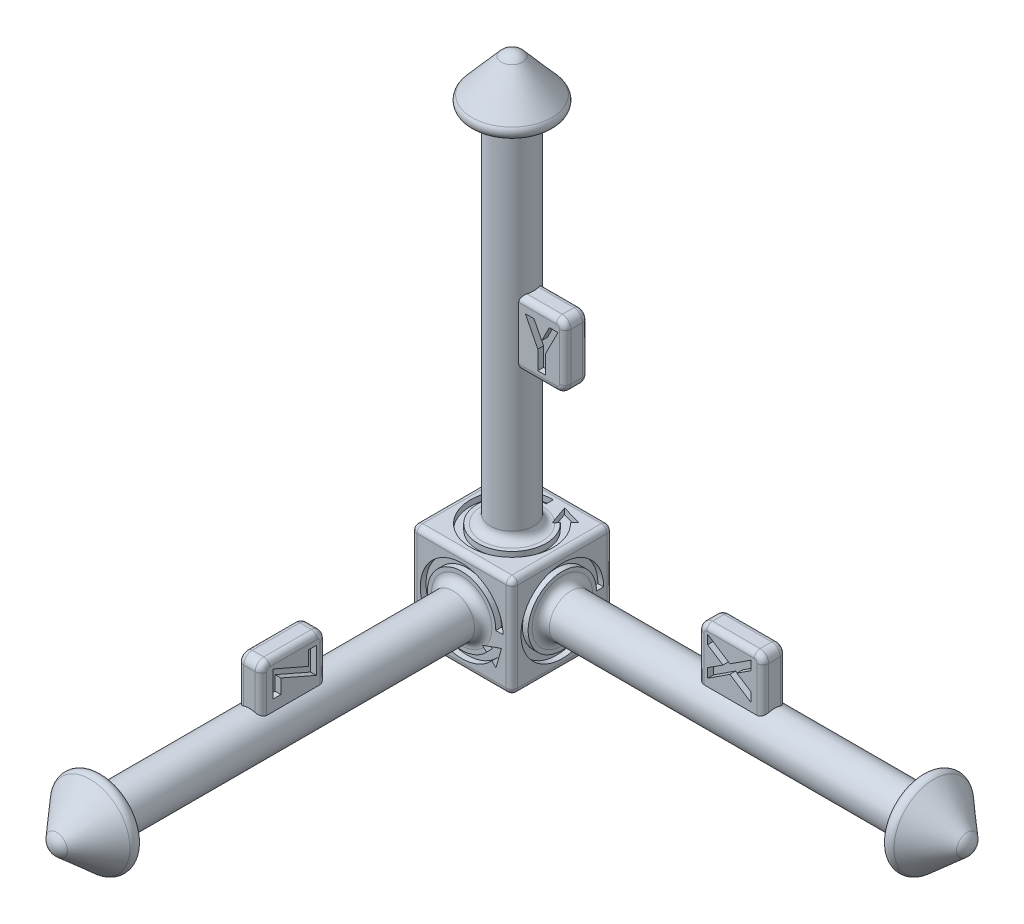
from build123d import *

# Parameters (mm, degrees)
FILLET1_R             = 1
SKETCH3_W             = 14
SKETCH3_H             = 14
BLOCK_DEPTH           = 14
X_AXIS_MATE_ANGLE     = 90
Z_AXIS_MATE_ANGLE     = 90
NEG_X_CUT_DEPTH       = 1.2
SKETCH6_W             = 9
SKETCH6_H             = 9
Y_FLAG_DEPTH          = 1.6
Y_CUT_DEPTH           = 0.8
SKETCH9_W             = 9
SKETCH9_H             = 10
X_FLAG_DEPTH          = 1.6
X_CUT_DEPTH           = 0.8
SKETCH11_W            = 9
SKETCH11_H            = 9
Z_FLAG_DEPTH          = 1.6
Z_CUT_DEPTH           = 0.8
NEG_Z_COUNT           = 2
NEG_Z_ANGLE           = 90
X_START               = -0.8
X_ROT_DEPTH           = 0.8
Y_ROT_COUNT           = 2
Y_ROT_ANGLE           = 90
Z_ROT_COUNT           = 2
Z_ROT_ANGLE           = 90
NEG_Y_COUNT           = 2
NEG_Y_ANGLE           = 90
SKETCH20_W            = 1.384615385
SKETCH20_H            = 0.666666667
NEG_X_LABEL_DEPTH     = 1.2
SKETCH21_W            = 1.384615385
SKETCH21_H            = 0.666666667
NEG_Z_LABEL_DEPTH     = 1.2
SKETCH22_W            = 0.666666667
SKETCH22_H            = 1.384615384
NEG_Y_LABEL_DEPTH     = 1.2
Y_LABEL_REVERSE_COUNT = 2
Z_LABEL_REVERSE_COUNT = 2
X_LABEL_REVERSE_COUNT = 2
FLAG_EDGE_R           = 0.8
FLAG_CORNER_R         = 1.2
CUBE_R                = 0.8
ARROWS_R              = 1.2


with BuildPart() as part:
    # Sketch1 → Y axis (revolve)
    with BuildSketch(Plane(origin=(0, 0, 0), x_dir=(0, 0, -1), z_dir=(1, 0, 0))):
        with BuildLine():
            Line((3, 50), (7, 50))
            Line((7, 50), (1.486725664, 56.300884956))
            ThreePointArc((1.486725664, 56.300884956), (0.816314478, 56.79896791), (0, 56.975513824))
            Line((0, 56.975513824), (0, 50))
            Line((0, 50), (0, 0))
            Line((0, 0), (3, 0))
            Line((3, 0), (3, 50))
        make_face()
    revolve(axis=Axis((0, 0, 0), (0, 1, 0)))

    # Fillet1
    fillet1_edges = [part.edges().sort_by_distance(p)[0] for p in [
        (0, 50, 7),
    ]]
    fillet(fillet1_edges, radius=FILLET1_R)


with BuildPart() as body_2:
    # Sketch3 → block (new body)
    with BuildSketch(Plane(origin=(0, 0, 0), x_dir=(-1, 0, 0), z_dir=(0, -1, 0))):
        Rectangle(SKETCH3_W, SKETCH3_H)
    extrude(amount=BLOCK_DEPTH)

    # Sketch5 → neg X cut (cut)
    with BuildSketch(Plane.ZY.offset(7)):
        with BuildLine():
            Line((3.464101615, -3.75), (2.880673975, -4.297368421))
            Line((2.880673975, -4.297368421), (5.539270206, -5.231106113))
            Line((5.539270206, -5.231106113), (4.776813806, -2.518421053))
            Line((4.776813806, -2.518421053), (4.193386166, -3.065789474))
            ThreePointArc((4.193386166, -3.065789474), (-5.346703211, -9.115482161), (5.75, -7))
            Line((5.75, -7), (4.75, -7))
            ThreePointArc((4.75, -7), (-4.416841783, -8.74757222), (3.464101615, -3.75))
        make_face()
    neg_x_cut = extrude(amount=-NEG_X_CUT_DEPTH, mode=Mode.SUBTRACT)


with BuildPart() as body_3:
    # X axis: copy of part
    add(part.part.moved(Location((30, 0, 0))))


with BuildPart() as body_3_1:
    # X axis mate: read off the stored shape, not the designer's step
    # X axis mate: moved
    add(body_3.part.moved(Location((-23, 7, 0))).rotate(Axis((0, 0, 0), (0, 0, -1)), X_AXIS_MATE_ANGLE))


with BuildPart() as body_4:
    # Z axis: copy of part
    add(part.part.moved(Location((30, 0, 0))))


with BuildPart() as body_4_1:
    # Z axis mate: read off the stored shape, not the designer's step
    # Z axis mate: moved
    add(body_4.part.moved(Location((-30, 7, 7))).rotate(Axis((0, 0, 0), (1, 0, 0)), Z_AXIS_MATE_ANGLE))


with BuildPart() as part_1:
    add(part.part)

    # Combine1: union body 2, body 3, body 4
    add(body_2.part)
    add(body_3_1.part)
    add(body_4_1.part)

    # Sketch6 → Y flag (add, symmetric)
    with BuildSketch(Plane.XY):
        with Locations((4.5, 25)):
            Rectangle(SKETCH6_W, SKETCH6_H)
    extrude(amount=Y_FLAG_DEPTH, both=True)

    # Sketch7 → Y cut (cut)
    with BuildSketch(Plane.XY.offset(1.6)):
        Polygon((3.461165446, 27.8), (4.659482754, 27.8), (5.730396216, 25.695432692), (6.801309677, 27.8), (7.999626985, 27.8), (6.268857754, 24.398557692), (6.268857754, 21.8), (5.191934677, 21.8), (5.191934677, 24.398557692), align=None)
    y_cut = extrude(amount=-Y_CUT_DEPTH, mode=Mode.SUBTRACT)

    # Sketch9 → X flag (add, symmetric)
    with BuildSketch(Plane.XY):
        with Locations((32, -2)):
            Rectangle(SKETCH9_W, SKETCH9_H)
    extrude(amount=X_FLAG_DEPTH, both=True)

    # Sketch10 → X cut (cut)
    with BuildSketch(Plane.XY.offset(1.6)):
        Polygon((34.8, 1.750828908), (34.8, 0.481598139), (32.873317308, -0.772007631), (34.8, -2.028017246), (34.8, -3.298449938), (31.898557692, -1.406623015), (28.8, -3.423449938), (28.8, -2.154219169), (30.925, -0.772007631), (28.8, 0.613809677), (28.8, 1.884242369), (31.899759615, -0.137392246), align=None)
    x_cut = extrude(amount=-X_CUT_DEPTH, mode=Mode.SUBTRACT)

    # Sketch11 → Z flag (add, symmetric)
    with BuildSketch(Plane(origin=(0, 0, 0), x_dir=(0, 0, -1), z_dir=(1, 0, 0))):
        with Locations((-32, -2.5)):
            Rectangle(SKETCH11_W, SKETCH11_H)
    extrude(amount=Z_FLAG_DEPTH, both=True)

    # Sketch13 → Z cut (cut)
    with BuildSketch(Plane(origin=(1.6, 0, 0), x_dir=(0, 0, -1), z_dir=(1, 0, 0))):
        Polygon((-34.8, -2.923449938), (-34.8, 0.691934677), (-29.876923077, -1.457103784), (-29.876923077, 0.538088523), (-28.8, 0.538088523), (-28.8, -3.077296092), (-33.723076923, -0.927055707), (-33.723076923, -2.923449938), align=None)
    z_cut = extrude(amount=-Z_CUT_DEPTH, mode=Mode.SUBTRACT)

    # neg Z: neg X cut ×2 about axis
    neg_z_axis = Axis((0, 0, 0), (0, -1, 0))
    for i in range(1, NEG_Z_COUNT):
        add(neg_x_cut.rotate(neg_z_axis, i * NEG_Z_ANGLE / (NEG_Z_COUNT - 1)), mode=Mode.SUBTRACT)

    # Sketch19 → X rot (cut)
    with BuildSketch(Plane(origin=(7, 0, 0), x_dir=(0, 0, -1), z_dir=(1, 0, 0)).offset(X_START)):
        with BuildLine():
            Line((4.75, -7), (5.75, -7))
            ThreePointArc((5.75, -7), (-5.346703211, -4.884517839), (4.193386166, -10.934210526))
            Line((4.193386166, -10.934210526), (4.776813806, -11.481578947))
            Line((4.776813806, -11.481578947), (5.539270206, -8.768893887))
            Line((5.539270206, -8.768893887), (2.880673975, -9.702631579))
            Line((2.880673975, -9.702631579), (3.464101615, -10.25))
            ThreePointArc((3.464101615, -10.25), (-4.416841783, -5.25242778), (4.75, -7))
        make_face()
    x_rot = extrude(amount=X_ROT_DEPTH, mode=Mode.SUBTRACT)

    # Y rot: X rot ×2 about axis
    y_rot_axis = Axis((0, -7, 0), (0, 0, 1))
    for i in range(1, Y_ROT_COUNT):
        add(x_rot.rotate(y_rot_axis, i * Y_ROT_ANGLE / (Y_ROT_COUNT - 1)), mode=Mode.SUBTRACT)

    # Z rot: X rot ×2 about axis
    z_rot_axis = Axis((0, 0, 0), (0, -1, 0))
    for i in range(1, Z_ROT_COUNT):
        add(x_rot.rotate(z_rot_axis, i * Z_ROT_ANGLE / (Z_ROT_COUNT - 1)), mode=Mode.SUBTRACT)

    # neg Y: neg X cut ×2 about axis
    neg_y_axis = Axis((0, -7, 0), (0, 0, 1))
    for i in range(1, NEG_Y_COUNT):
        add(neg_x_cut.rotate(neg_y_axis, i * NEG_Y_ANGLE / (NEG_Y_COUNT - 1)), mode=Mode.SUBTRACT)

    # Sketch20 → neg X label (cut)
    with BuildSketch(Plane.ZY.offset(7)):
        with Locations((-2.871794872, -7.538461539)):
            Rectangle(SKETCH20_W, SKETCH20_H)
        Polygon((-1.500801282, -5), (-0.654647436, -5), (0.181089744, -6.284455128), (1.018429487, -5), (1.865384615, -5), (0.604166667, -6.934294872), (1.948717949, -9), (1.102564103, -9), (0.181089744, -7.583333333), (-0.742788462, -9), (-1.58974359, -9), (-0.241987179, -6.93349359), align=None)
    extrude(amount=-NEG_X_LABEL_DEPTH, mode=Mode.SUBTRACT)

    # Sketch21 → neg Z label (cut)
    with BuildSketch(Plane(origin=(0, 0, -7), x_dir=(-1, 0, 0), z_dir=(0, 0, -1))):
        with Locations((-2.384615384, -7.538461539)):
            Rectangle(SKETCH21_W, SKETCH21_H)
        Polygon((-0.974358974, -5), (1.435897436, -5), (0.003205128, -8.282051282), (1.333333333, -8.282051282), (1.333333333, -9), (-1.076923077, -9), (0.356570513, -5.717948718), (-0.974358974, -5.717948718), align=None)
    extrude(amount=-NEG_Z_LABEL_DEPTH, mode=Mode.SUBTRACT)

    # Sketch22 → neg Y label (cut)
    with BuildSketch(Plane(origin=(0, -14, 0), x_dir=(-1, 0, 0), z_dir=(0, -1, 0))):
        with Locations((0.538461539, -2.717948718)):
            Rectangle(SKETCH22_W, SKETCH22_H)
        Polygon((-2, -1.435897436), (-2, -0.637019231), (-0.596955128, 0.076923077), (-2, 0.790865385), (-2, 1.58974359), (0.267628205, 0.435897436), (2, 0.435897436), (2, -0.282051282), (0.267628205, -0.282051282), align=None)
    extrude(amount=-NEG_Y_LABEL_DEPTH, mode=Mode.SUBTRACT)

    # y label reverse: Y cut ×2 about axis
    y_label_reverse_axis = Axis((5.768857754, 0, 0), (0, 1, 0))
    for i in range(1, Y_LABEL_REVERSE_COUNT):
        add(y_cut.rotate(y_label_reverse_axis, i * 360 / Y_LABEL_REVERSE_COUNT), mode=Mode.SUBTRACT)

    # Z label reverse: Z cut ×2 about axis
    z_label_reverse_axis = Axis((0, -1.231142246, 0), (0, 0, 1))
    for i in range(1, Z_LABEL_REVERSE_COUNT):
        add(z_cut.rotate(z_label_reverse_axis, i * 360 / Z_LABEL_REVERSE_COUNT), mode=Mode.SUBTRACT)

    # X label reverse: X cut ×2 about axis
    x_label_reverse_axis = Axis((0, -0.731142246, 0), (1, 0, 0))
    for i in range(1, X_LABEL_REVERSE_COUNT):
        add(x_cut.rotate(x_label_reverse_axis, i * 360 / X_LABEL_REVERSE_COUNT), mode=Mode.SUBTRACT)

    # flag edge
    flag_edge_edges = [part_1.edges().sort_by_distance(p)[0] for p in [
        (27.5, -0.731142246, 1.6),
        (-1.6, -1.231142246, 36.5),
        (-1.6, -1.231142246, 27.5),
        (-1.6, 2, 32),
        (1.6, -1.231142246, 27.5),
        (1.6, 2, 32),
        (1.6, -1.231142246, 36.5),
        (5.768857754, 20.5, -1.6),
        (9, 25, -1.6),
        (5.768857754, 29.5, -1.6),
        (5.768857754, 20.5, 1.6),
        (9, 25, 1.6),
        (5.768857754, 29.5, 1.6),
        (27.5, -0.731142246, -1.6),
        (36.5, -0.731142246, -1.6),
        (32, 3, -1.6),
        (36.5, -0.731142246, 1.6),
        (32, 3, 1.6),
    ]]
    fillet(flag_edge_edges, radius=FLAG_EDGE_R)

    # flag corner
    # the kernel refuses this fillet: 1.2 mm, written as the material it takes off along each edge
    with BuildSketch(Plane(origin=(7.8, 21.7, -1.6), x_dir=(1, 0, 0), z_dir=(0, 1, 0))) as flag_corner_piece_1:
        with BuildLine():
            CenterArc((0.4, -0.8), 0.8, 0, 90)
            Line((1.2, -0.8), (1.2, 0))
            Line((1.2, 0), (0.4, 0))
        make_face()
    revolve(axis=Axis((7.8, 21.7, -1.6), (0, 0, -1)), revolution_arc=90, mode=Mode.SUBTRACT)
    with BuildSketch(Plane(origin=(7.8, 28.3, -1.6), x_dir=(0, 1, 0), z_dir=(-1, 0, 0))) as flag_corner_piece_2:
        with BuildLine():
            CenterArc((0.4, -0.8), 0.8, 0, 90)
            Line((1.2, -0.8), (1.2, 0))
            Line((1.2, 0), (0.4, 0))
        make_face()
    revolve(axis=Axis((7.8, 28.3, -1.6), (0, 0, -1)), revolution_arc=90, mode=Mode.SUBTRACT)
    with BuildSketch(Plane(origin=(-1.6, 0.8, 28.7), x_dir=(0, 1, 0), z_dir=(0, 0, 1))) as flag_corner_piece_3:
        with BuildLine():
            CenterArc((0.4, -0.8), 0.8, 0, 90)
            Line((1.2, -0.8), (1.2, 0))
            Line((1.2, 0), (0.4, 0))
        make_face()
    revolve(axis=Axis((-1.6, 0.8, 28.7), (-1, 0, 0)), revolution_arc=90, mode=Mode.SUBTRACT)
    with BuildSketch(Plane(origin=(-1.6, 0.8, 35.3), x_dir=(0, 0, 1), z_dir=(0, -1, 0))) as flag_corner_piece_4:
        with BuildLine():
            CenterArc((0.4, -0.8), 0.8, 0, 90)
            Line((1.2, -0.8), (1.2, 0))
            Line((1.2, 0), (0.4, 0))
        make_face()
    revolve(axis=Axis((-1.6, 0.8, 35.3), (-1, 0, 0)), revolution_arc=90, mode=Mode.SUBTRACT)
    with BuildSketch(Plane(origin=(1.6, 0.8, 35.3), x_dir=(0, 1, 0), z_dir=(0, 0, -1))) as flag_corner_piece_5:
        with BuildLine():
            CenterArc((0.4, -0.8), 0.8, 0, 90)
            Line((1.2, -0.8), (1.2, 0))
            Line((1.2, 0), (0.4, 0))
        make_face()
    revolve(axis=Axis((1.6, 0.8, 35.3), (1, 0, 0)), revolution_arc=90, mode=Mode.SUBTRACT)
    with BuildSketch(Plane(origin=(1.6, 0.8, 28.7), x_dir=(0, 1.4400332778071367e-12, -1.0), z_dir=(0, -1.0, -1.4400332778071367e-12))) as flag_corner_piece_6:
        with BuildLine():
            CenterArc((0.4, -0.8), 0.8, 0, 90)
            Line((1.2, -0.8), (1.2, 0))
            Line((1.2, 0), (0.4, 0))
        make_face()
    revolve(axis=Axis((1.6, 0.8, 28.7), (1, 0, 0)), revolution_arc=90, mode=Mode.SUBTRACT)
    with BuildSketch(Plane(origin=(7.8, 21.7, 1.6), x_dir=(0, -1, 0), z_dir=(-1, 0, 0))) as flag_corner_piece_7:
        with BuildLine():
            CenterArc((0.4, -0.8), 0.8, 0, 90)
            Line((1.2, -0.8), (1.2, 0))
            Line((1.2, 0), (0.4, 0))
        make_face()
    revolve(axis=Axis((7.8, 21.7, 1.6), (0, 0, 1)), revolution_arc=90, mode=Mode.SUBTRACT)
    with BuildSketch(Plane(origin=(7.8, 28.3, 1.6), x_dir=(1, 0, 0), z_dir=(0, -1, 0))) as flag_corner_piece_8:
        with BuildLine():
            CenterArc((0.4, -0.8), 0.8, 0, 90)
            Line((1.2, -0.8), (1.2, 0))
            Line((1.2, 0), (0.4, 0))
        make_face()
    revolve(axis=Axis((7.8, 28.3, 1.6), (0, 0, 1)), revolution_arc=90, mode=Mode.SUBTRACT)
    with BuildSketch(Plane(origin=(35.3, 1.8, 1.6), x_dir=(1, 0, 0), z_dir=(0, -1, 0))) as flag_corner_piece_9:
        with BuildLine():
            CenterArc((0.4, -0.8), 0.8, 0, 90)
            Line((1.2, -0.8), (1.2, 0))
            Line((1.2, 0), (0.4, 0))
        make_face()
    revolve(axis=Axis((35.3, 1.8, 1.6), (0, 0, 1)), revolution_arc=90, mode=Mode.SUBTRACT)
    with BuildSketch(Plane(origin=(28.7, 1.8, 1.6), x_dir=(0, 1, 0), z_dir=(1, 0, 0))) as flag_corner_piece_10:
        with BuildLine():
            CenterArc((0.4, -0.8), 0.8, 0, 90)
            Line((1.2, -0.8), (1.2, 0))
            Line((1.2, 0), (0.4, 0))
        make_face()
    revolve(axis=Axis((28.7, 1.8, 1.6), (0, 0, 1)), revolution_arc=90, mode=Mode.SUBTRACT)
    with BuildSketch(Plane(origin=(35.3, 1.8, -1.6), x_dir=(0, 1, 0), z_dir=(-1, 0, 0))) as flag_corner_piece_11:
        with BuildLine():
            CenterArc((0.4, -0.8), 0.8, 0, 90)
            Line((1.2, -0.8), (1.2, 0))
            Line((1.2, 0), (0.4, 0))
        make_face()
    revolve(axis=Axis((35.3, 1.8, -1.6), (0, 0, -1)), revolution_arc=90, mode=Mode.SUBTRACT)
    with BuildSketch(Plane(origin=(28.7, 1.8, -1.6), x_dir=(-1, 0, 0), z_dir=(0, -1, 0))) as flag_corner_piece_12:
        with BuildLine():
            CenterArc((0.4, -0.8), 0.8, 0, 90)
            Line((1.2, -0.8), (1.2, 0))
            Line((1.2, 0), (0.4, 0))
        make_face()
    revolve(axis=Axis((28.7, 1.8, -1.6), (0, 0, -1)), revolution_arc=90, mode=Mode.SUBTRACT)
    with BuildSketch(Plane(origin=(9, 29.5, -1.6), x_dir=(-1, 0, 0), z_dir=(0, 0, 1))) as flag_corner_piece_13:
        with BuildLine():
            CenterArc((FLAG_CORNER_R, FLAG_CORNER_R), FLAG_CORNER_R, 180, 90)
            Line((0, FLAG_CORNER_R), (0, 0))
            Line((0, 0), (FLAG_CORNER_R, 0))
        make_face()
    extrude(amount=3.2, mode=Mode.SUBTRACT)
    with BuildSketch(Plane(origin=(9, 20.5, -1.6), x_dir=(-1, 0, 0), z_dir=(0, 0, 1)), Plane(origin=(1.6, 2, 36.5), x_dir=(0, -1, 0), z_dir=(-1, 0, 0)), Plane(origin=(-1.6, 2, 27.5), x_dir=(0, -1.0, -1.4388490399162743e-12), z_dir=(1, 0, 0)), Plane(origin=(27.5, 3, 1.6), x_dir=(0, -1, 0), z_dir=(0, 0, -1)), Plane(origin=(36.5, 3, -1.6), x_dir=(0, -1, 0), z_dir=(0, 0, 1))) as flag_corner_piece_14:
        with BuildLine():
            CenterArc((FLAG_CORNER_R, -FLAG_CORNER_R), FLAG_CORNER_R, 90, 90)
            Line((0, -FLAG_CORNER_R), (0, 0))
            Line((0, 0), (FLAG_CORNER_R, 0))
        make_face()
    extrude(amount=3.2, mode=Mode.SUBTRACT)

    # cube
    cube_edges = [part_1.edges().sort_by_distance(p)[0] for p in [
        (7, 0, 0),
        (7, -7, -7),
        (0, 0, 7),
        (7, -7, 7),
        (-7, 0, 0),
        (-7, -7, 7),
        (0, 0, -7),
        (-7, -7, -7),
        (7, -14, 0),
        (0, -14, 7),
        (-7, -14, 0),
        (0, -14, -7),
    ]]
    fillet(cube_edges, radius=CUBE_R)

    # arrows
    # the kernel refuses this fillet: 1.2 mm, written as the material it adds along each edge
    with BuildSketch(Plane(origin=(7, -7, 0), x_dir=(0, 0, -1), z_dir=(0, -1, 0))) as arrows_piece_1_section:
        with BuildLine():
            CenterArc((3 + ARROWS_R, ARROWS_R), ARROWS_R, 180, 90)
            Line((3, ARROWS_R), (3, 0))
            Line((3, 0), (3 + ARROWS_R, 0))
        make_face()
    arrows_piece_1 = revolve(axis=Axis((7, -7, 0), (1, 0, 0)), mode=Mode.PRIVATE)
    arrows_piece_1 = split(arrows_piece_1, bisect_by=Plane(origin=(7, -7, 0), z_dir=(0, 0.7292845505553172, -0.684210526315789)), keep=Keep.TOP, mode=Mode.PRIVATE)
    arrows_piece_1 = split(arrows_piece_1, bisect_by=Plane(origin=(7, -10.3065035, -1.161292155), z_dir=(0, 0.9435004977183524, 0.33137110737845166)), keep=Keep.TOP, mode=Mode.PRIVATE)
    add(arrows_piece_1)
    with BuildSketch(Plane(origin=(7, -7, 0), x_dir=(0, 0, -1), z_dir=(0, -1, 0))) as arrows_piece_2_section:
        with BuildLine():
            CenterArc((3 + ARROWS_R, ARROWS_R), ARROWS_R, 180, 90)
            Line((3, ARROWS_R), (3, 0))
            Line((3, 0), (3 + ARROWS_R, 0))
        make_face()
    arrows_piece_2 = revolve(axis=Axis((7, -7, 0), (1, 0, 0)), mode=Mode.PRIVATE)
    arrows_piece_2 = split(arrows_piece_2, bisect_by=Plane(origin=(7, -7, 0), z_dir=(0, -0.7292845505553172, 0.684210526315789)), keep=Keep.TOP, mode=Mode.PRIVATE)
    arrows_piece_2 = split(arrows_piece_2, bisect_by=Plane(origin=(7, -10.3065035, -1.161292155), z_dir=(0, 0.9435004977183524, 0.33137110737845166)), keep=Keep.TOP, mode=Mode.PRIVATE)
    add(arrows_piece_2)
    with BuildSketch(Plane(origin=(7, -7, 0), x_dir=(0, 0, -1), z_dir=(0, -1, 0))) as arrows_piece_3_section:
        with BuildLine():
            CenterArc((3 + ARROWS_R, ARROWS_R), ARROWS_R, 180, 90)
            Line((3, ARROWS_R), (3, 0))
            Line((3, 0), (3 + ARROWS_R, 0))
        make_face()
    arrows_piece_3 = revolve(axis=Axis((7, -7, 0), (1, 0, 0)), mode=Mode.PRIVATE)
    arrows_piece_3 = split(arrows_piece_3, bisect_by=Plane(origin=(7, -7, 0), z_dir=(0, -0.7292845505553172, 0.684210526315789)), keep=Keep.TOP, mode=Mode.PRIVATE)
    arrows_piece_3 = split(arrows_piece_3, bisect_by=Plane(origin=(7, -10.3065035, -1.161292155), z_dir=(0, -0.9435004977183524, -0.33137110737845166)), keep=Keep.TOP, mode=Mode.PRIVATE)
    add(arrows_piece_3)
    with BuildSketch(Plane(origin=(0, -7, 7), x_dir=(0, 1, 0), z_dir=(1, 0, 0))) as arrows_piece_4_section:
        with BuildLine():
            CenterArc((3 + ARROWS_R, ARROWS_R), ARROWS_R, 180, 90)
            Line((3, ARROWS_R), (3, 0))
            Line((3, 0), (3 + ARROWS_R, 0))
        make_face()
    arrows_piece_4 = revolve(axis=Axis((0, -7, 7), (0, 0, 1)), mode=Mode.PRIVATE)
    arrows_piece_4 = split(arrows_piece_4, bisect_by=Plane(origin=(0, -7, 7), z_dir=(0.684210526315789, 0.7292845505553172, 2.430804096021394e-15)), keep=Keep.TOP, mode=Mode.PRIVATE)
    arrows_piece_4 = split(arrows_piece_4, bisect_by=Plane(origin=(1.161292155, -10.3065035, 7), z_dir=(-0.33137110737845166, 0.9435004977183524, -1.1772666659426948e-15)), keep=Keep.TOP, mode=Mode.PRIVATE)
    add(arrows_piece_4)
    with BuildSketch(Plane(origin=(0, -7, 7), x_dir=(0, 1, 0), z_dir=(1, 0, 0))) as arrows_piece_5_section:
        with BuildLine():
            CenterArc((3 + ARROWS_R, ARROWS_R), ARROWS_R, 180, 90)
            Line((3, ARROWS_R), (3, 0))
            Line((3, 0), (3 + ARROWS_R, 0))
        make_face()
    arrows_piece_5 = revolve(axis=Axis((0, -7, 7), (0, 0, 1)), mode=Mode.PRIVATE)
    arrows_piece_5 = split(arrows_piece_5, bisect_by=Plane(origin=(0, -7, 7), z_dir=(-0.684210526315789, -0.7292845505553172, -2.430804096021394e-15)), keep=Keep.TOP, mode=Mode.PRIVATE)
    arrows_piece_5 = split(arrows_piece_5, bisect_by=Plane(origin=(1.161292155, -10.3065035, 7), z_dir=(-0.33137110737845166, 0.9435004977183524, -1.1772666659426948e-15)), keep=Keep.TOP, mode=Mode.PRIVATE)
    add(arrows_piece_5)
    with BuildSketch(Plane(origin=(0, -7, 7), x_dir=(0, 1, 0), z_dir=(1, 0, 0))) as arrows_piece_6_section:
        with BuildLine():
            CenterArc((3 + ARROWS_R, ARROWS_R), ARROWS_R, 180, 90)
            Line((3, ARROWS_R), (3, 0))
            Line((3, 0), (3 + ARROWS_R, 0))
        make_face()
    arrows_piece_6 = revolve(axis=Axis((0, -7, 7), (0, 0, 1)), mode=Mode.PRIVATE)
    arrows_piece_6 = split(arrows_piece_6, bisect_by=Plane(origin=(0, -7, 7), z_dir=(-0.684210526315789, -0.7292845505553172, -2.430804096021394e-15)), keep=Keep.TOP, mode=Mode.PRIVATE)
    arrows_piece_6 = split(arrows_piece_6, bisect_by=Plane(origin=(1.161292155, -10.3065035, 7), z_dir=(0.33137110737845166, -0.9435004977183524, 1.1772666659426948e-15)), keep=Keep.TOP, mode=Mode.PRIVATE)
    add(arrows_piece_6)
    with BuildSketch(Plane(origin=(0, 0, 0), x_dir=(0, 0, -1), z_dir=(1, 0, 0))) as arrows_piece_7_section:
        with BuildLine():
            CenterArc((3 + ARROWS_R, ARROWS_R), ARROWS_R, 180, 90)
            Line((3, ARROWS_R), (3, 0))
            Line((3, 0), (3 + ARROWS_R, 0))
        make_face()
    arrows_piece_7 = revolve(axis=Axis((0, 0, 0), (0, 1, 0)), mode=Mode.PRIVATE)
    arrows_piece_7 = split(arrows_piece_7, bisect_by=Plane(origin=(0, 0, 0), z_dir=(-0.7292845505553172, -2.5909391984957507e-15, -0.684210526315789)), keep=Keep.TOP, mode=Mode.PRIVATE)
    arrows_piece_7 = split(arrows_piece_7, bisect_by=Plane(origin=(3.3065035, 0, -1.161292155), z_dir=(-0.9435004977183524, -3.3519871241990715e-15, 0.33137110737845166)), keep=Keep.TOP, mode=Mode.PRIVATE)
    add(arrows_piece_7)
    with BuildSketch(Plane(origin=(0, 0, 0), x_dir=(0, 0, -1), z_dir=(1, 0, 0))) as arrows_piece_8_section:
        with BuildLine():
            CenterArc((3 + ARROWS_R, ARROWS_R), ARROWS_R, 180, 90)
            Line((3, ARROWS_R), (3, 0))
            Line((3, 0), (3 + ARROWS_R, 0))
        make_face()
    arrows_piece_8 = revolve(axis=Axis((0, 0, 0), (0, 1, 0)), mode=Mode.PRIVATE)
    arrows_piece_8 = split(arrows_piece_8, bisect_by=Plane(origin=(0, 0, 0), z_dir=(0.7292845505553172, 2.5909391984957507e-15, 0.684210526315789)), keep=Keep.TOP, mode=Mode.PRIVATE)
    arrows_piece_8 = split(arrows_piece_8, bisect_by=Plane(origin=(3.3065035, 0, -1.161292155), z_dir=(-0.9435004977183524, -3.3519871241990715e-15, 0.33137110737845166)), keep=Keep.TOP, mode=Mode.PRIVATE)
    add(arrows_piece_8)
    with BuildSketch(Plane(origin=(0, 0, 0), x_dir=(0, 0, -1), z_dir=(1, 0, 0))) as arrows_piece_9_section:
        with BuildLine():
            CenterArc((3 + ARROWS_R, ARROWS_R), ARROWS_R, 180, 90)
            Line((3, ARROWS_R), (3, 0))
            Line((3, 0), (3 + ARROWS_R, 0))
        make_face()
    arrows_piece_9 = revolve(axis=Axis((0, 0, 0), (0, 1, 0)), mode=Mode.PRIVATE)
    arrows_piece_9 = split(arrows_piece_9, bisect_by=Plane(origin=(0, 0, 0), z_dir=(0.7292845505553172, 2.5909391984957507e-15, 0.684210526315789)), keep=Keep.TOP, mode=Mode.PRIVATE)
    arrows_piece_9 = split(arrows_piece_9, bisect_by=Plane(origin=(3.3065035, 0, -1.161292155), z_dir=(0.9435004977183524, 3.3519871241990715e-15, -0.33137110737845166)), keep=Keep.TOP, mode=Mode.PRIVATE)
    add(arrows_piece_9)


solid = part_1.part
